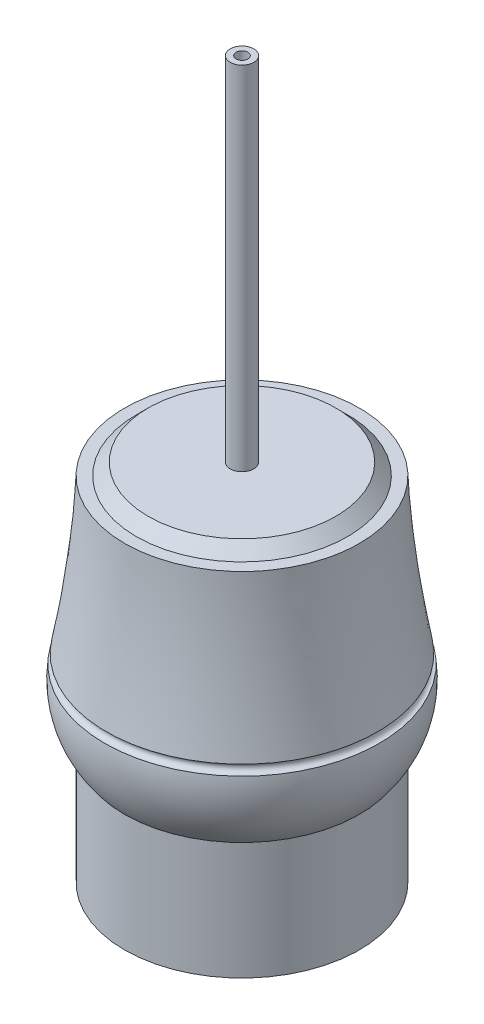
from build123d import *

# Parameters (mm, degrees)
SKETCH2_R           = 10
BOSS_EXTRUDE1_DEPTH = 10
FILLET1_R           = 8
SKETCH5_R           = 0.4
SKETCH6_R           = 9
BOSS_EXTRUDE2_DEPTH = 1
CHAMFER1_SIZE       = 1
SKETCH7_R           = 1
BOSS_EXTRUDE3_DEPTH = 30
SKETCH8_R           = 0.5
CUT_EXTRUDE1_DEPTH  = 1


with BuildPart() as part:
    # Sketch2 → Boss-Extrude1 (new body)
    with BuildSketch(Plane(origin=(0, 0, 0), x_dir=(1, 0, 0), z_dir=(0, 1, 0))):
        with Locations(Location((0, 0, 0), (0, 0, 270))):
            Circle(SKETCH2_R)
    extrude(amount=BOSS_EXTRUDE1_DEPTH)

    # Loft1: read off the stored shape, not the designer's step
    # Loft1: loft between two sections, ruled curve by curve
    loft1_from = [
        Edge.make_bspline([(-12.860252555, 10, 1.901027147), (-9.058198262, 10, 27.621532257), (16.662306849, 10, 23.819477964), (12.860252555, 10, -1.901027147), (9.058198262, 10, -27.621532257), (-16.662306849, 10, -23.819477964), (-12.860252555, 10, 1.901027147)], [0, 0, 0, 0, 0.5, 0.5, 0.5, 1, 1, 1, 1], 3, [1, 0.333333333, 0.333333333, 1, 0.333333333, 0.333333333, 1]),
    ]
    loft1_to = [
        Edge.make_bspline([(-9.079588938, 30, -4.190592406), (-17.460773749, 30, 13.968585471), (0.698404127, 30, 22.349770282), (9.079588938, 30, 4.190592406), (17.460773749, 30, -13.968585471), (-0.698404127, 30, -22.349770282), (-9.079588938, 30, -4.190592406)], [0, 0, 0, 0, 0.5, 0.5, 0.5, 1, 1, 1, 1], 3, [1, 0.333333333, 0.333333333, 1, 0.333333333, 0.333333333, 1]),
    ]
    loft1 = Solid(Shell([*[Face.make_surface_from_curves(loft1_from[k], loft1_to[k]) for k in range(1)], Face(Wire(loft1_from)), Face(Wire(loft1_to))]))
    add(loft1)

    # Fillet1
    # the kernel refuses this fillet: 8 mm, written as the material it takes off along each edge
    with BuildSketch(Plane(origin=(0, 10, 0), x_dir=(-0.9892501965607676, 0, 0.14623285747219308), z_dir=(-0.14623285747219308, 0, -0.9892501965607676))) as fillet1_piece_1:
        with BuildLine():
            CenterArc((3.770111358, 5.018813356), FILLET1_R, 321.144997334, 49.449726364)
            Line((10, 0), (10.124597773, -0.100376267))
            ThreePointArc((10.124597773, -0.100376267), (11.5, -0.16), (13, -0.16))
            Line((13, -0.16), (13.155876196, 0.036091708))
            ThreePointArc((13.155876196, 0.036091708), (12.43891649, 3.270626899), (11.791002002, 6.519117749))
            Line((11.791002002, 6.519117749), (11.633729636, 6.489700016))
        make_face()
    revolve(axis=Axis((0, 10, 0), (0, 1, 0)), mode=Mode.SUBTRACT)

    # Sketch5 → Cut-Revolve1 (revolve, cut)
    with BuildSketch(Plane(origin=(0, 0, 0), x_dir=(0, 0, -1), z_dir=(1, 0, 0))):
        with Locations((-11.633729637, 16.489700016)):
            Circle(SKETCH5_R)
    revolve(axis=Axis((0, 16.489700016, 0), (0, 1, 0)), mode=Mode.SUBTRACT)

    # Sketch6 → Boss-Extrude2 (add)
    with BuildSketch(Plane(origin=(0, 30, 0), x_dir=(1, 0, 0), z_dir=(0, 1, 0))):
        with Locations(Location((0, 0, 0), (0, 0, 270))):
            Circle(SKETCH6_R)
    extrude(amount=BOSS_EXTRUDE2_DEPTH)

    # Chamfer1
    chamfer1_edges = [part.edges().sort_by_distance(p)[0] for p in [
        (0, 31, -9),
    ]]
    chamfer(chamfer1_edges, length=CHAMFER1_SIZE - 0.0001)  # a hair under: the kernel refuses the full size

    # Sketch7 → Boss-Extrude3 (add)
    with BuildSketch(Plane(origin=(0, 31, 0), x_dir=(1, 0, 0), z_dir=(0, 1, 0))):
        with Locations(Location((0, 0, 0), (0, 0, 270))):
            Circle(SKETCH7_R)
    extrude(amount=BOSS_EXTRUDE3_DEPTH)

    # Sketch8 → Cut-Extrude1 (cut)
    with BuildSketch(Plane(origin=(0, 61, 0), x_dir=(1, 0, 0), z_dir=(0, 1, 0))):
        with Locations(Location((0, 0, 0), (0, 0, 270))):
            Circle(SKETCH8_R)
    extrude(amount=-CUT_EXTRUDE1_DEPTH, mode=Mode.SUBTRACT)


solid = part.part
